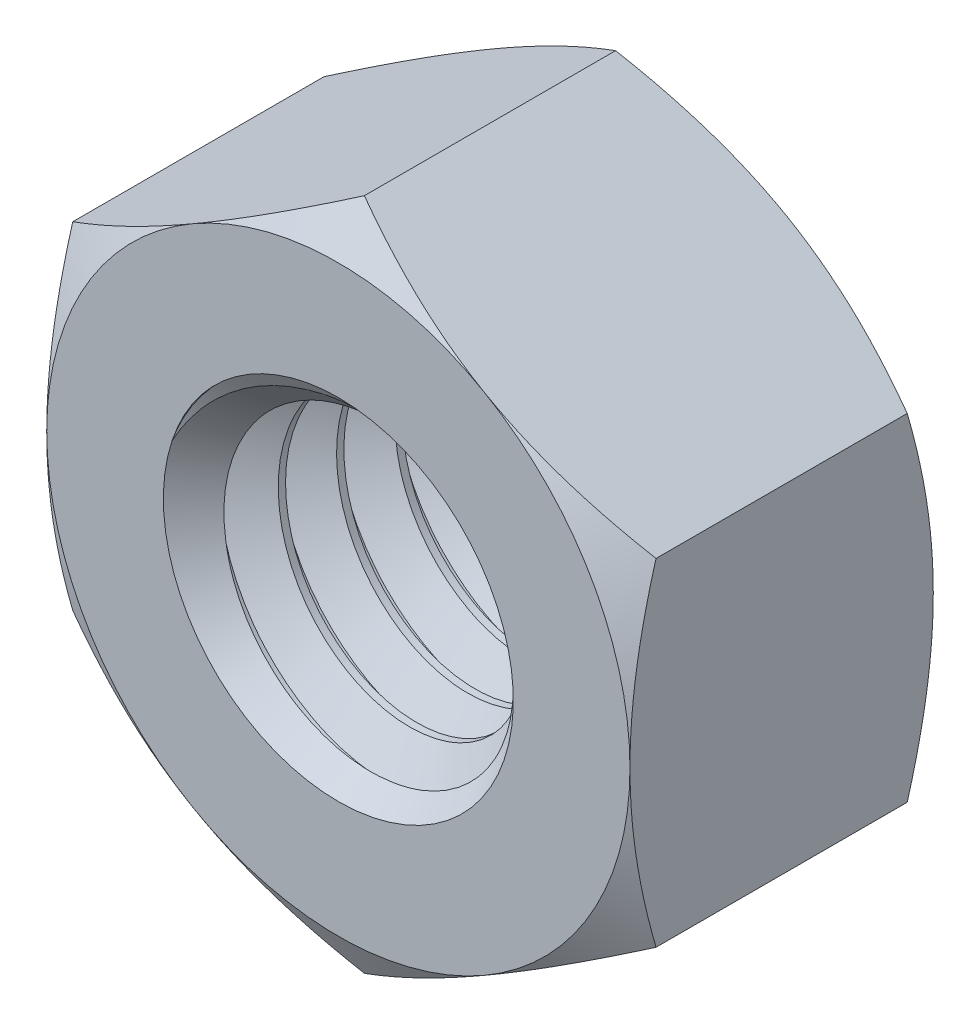
from build123d import *

# Parameters (mm, degrees)
EXTRUDE1_DEPTH          = 2.6
SKETCH13_R              = 3
BOSS_EXTRUDE1_DEPTH     = 5.2
CUT_SWEEP1_PITCH        = 1
SKETCH7_OUTSIDE_W       = 103.216
SKETCH7_OUTSIDE_H       = 104.764
SKETCH7_OUTSIDE_R       = 5
EXTRUDE2_DEPTH          = 25.4
EXTRUDE2_DRAFT          = -60
MIRROR2_COPY_1_SKETCH_W = 103.216
MIRROR2_COPY_1_SKETCH_H = 104.764
MIRROR2_COPY_1_SKETCH_R = 5
MIRROR2_COPY_1_DEPTH    = 25.4
MIRROR2_COPY_1_DRAFT    = -60


with BuildPart() as part:
    # Sketch1 → Extrude1 (new, symmetric)
    with BuildSketch(Plane.XY):
        Polygon((-5, 2.886751346), (-5, -2.886751346), (0, -5.773502692), (5, -2.886751346), (5, 2.886751346), (0, 5.773502692), align=None)
    extrude(amount=EXTRUDE1_DEPTH, both=True)

    # Cut-Extrude2 cone 1 section (through the dimple's axis) → Cut-Extrude2 (revolve, cut)
    with BuildSketch(Plane(origin=(0, 0, 2.6), x_dir=(0, -1, 0), z_dir=(1, 0, 0))):
        Polygon((0, 0), (3, 0), (0, 3), align=None)
    revolve(axis=Axis((0, 0, 2.6), (0, 0, -1)), mode=Mode.SUBTRACT)

    # Cut-Extrude3 cone 1 section (through the dimple's axis) → Cut-Extrude3 (revolve, cut)
    with BuildSketch(Plane(origin=(0, 0, -2.6), x_dir=(0, 1, 0), z_dir=(1, 0, 0))):
        Polygon((0, 0), (3, 0), (0, 3), align=None)
    revolve(axis=Axis((0, 0, -2.6), (0, 0, 1)), mode=Mode.SUBTRACT)


with BuildPart() as body_2:
    # Sketch13 → Boss-Extrude1 (new body)
    with BuildSketch(Plane(origin=(0, 0, -2.6), x_dir=(-1, 0, 0), z_dir=(0, 0, -1))):
        Circle(SKETCH13_R)
    extrude(amount=-BOSS_EXTRUDE1_DEPTH)

    # Cut-Sweep1: arcs per turn and ends read off the stored shape
    # Cut-Sweep1: the profile of Sketch12 profile screwed along a right-hand helix through 7 turns, 8 arcs to a turn; built about Z, then put on its axis
    cut_sweep1_z = Axis((0, 0, 0), (0, 0, 1))
    cut_sweep1_corners = [(3.0003, 0, -1.875173205), (3.0003, 0, -0.999826795), (2.350480947, 0, -1.375), (2.350480947, 0, -1.5)]
    with BuildLine(mode=Mode.PRIVATE) as cut_sweep1_profile:
        Line(cut_sweep1_corners[0], cut_sweep1_corners[1])
        Line(cut_sweep1_corners[1], cut_sweep1_corners[2])
        Line(cut_sweep1_corners[2], cut_sweep1_corners[3])
        Line(cut_sweep1_corners[3], cut_sweep1_corners[0])
    cut_sweep1_cap = Face(cut_sweep1_profile.wire())
    cut_sweep1_turn_angles = [0, 22.5, 45, 67.5, 90, 112.5, 135, 157.5, 180, 202.5, 225, 247.5, 270, 292.5, 315, 337.5, 360]
    cut_sweep1_turn_weights = [1, 0.9238795325112867, 1, 0.9238795325112867, 1, 0.9238795325112867, 1, 0.9238795325112867, 1, 0.9238795325112867, 1, 0.9238795325112867, 1, 0.9238795325112867, 1, 0.9238795325112867, 1]
    cut_sweep1_turn_rails = [Edge.make_bspline([Vector(p[0], p[1], 0).rotate(cut_sweep1_z, cut_sweep1_turn_angles[k]) / cut_sweep1_turn_weights[k] + Vector(0, 0, p[2] + CUT_SWEEP1_PITCH * cut_sweep1_turn_angles[k] / 360) for k in range(17)], [0, 0, 0, 1, 1, 2, 2, 3, 3, 4, 4, 5, 5, 6, 6, 7, 7, 8, 8, 8], 2, cut_sweep1_turn_weights) for p in cut_sweep1_corners]
    cut_sweep1_turn_sides = [Face.make_surface_from_curves(cut_sweep1_turn_rails[p[0]], cut_sweep1_turn_rails[p[1]]) for p in [(0, 1), (1, 2), (2, 3), (3, 0)]]
    cut_sweep1 = Plane(origin=(0, 0, -2.6), x_dir=(0, 1, 0), z_dir=(0, 0, 1)) * Solid(Shell([*[p.moved(Location((0, 0, CUT_SWEEP1_PITCH * i))) for i in range(7) for p in cut_sweep1_turn_sides], cut_sweep1_cap, cut_sweep1_cap.rotate(cut_sweep1_z, 2520).moved(Location((0, 0, CUT_SWEEP1_PITCH * 2520 / 360)))]))
    add(cut_sweep1, mode=Mode.SUBTRACT)


with BuildPart() as part_1:
    add(part.part)

    # Combine1: cut body 2
    add(body_2.part, mode=Mode.SUBTRACT)


with BuildPart() as extrude2_tool:
    # Sketch7 outside → Extrude2 (with draft: the straight prism first)
    with BuildSketch(Plane.XY.offset(2.6)):
        Rectangle(SKETCH7_OUTSIDE_W, SKETCH7_OUTSIDE_H)
        Circle(SKETCH7_OUTSIDE_R, mode=Mode.SUBTRACT)
    extrude(amount=-EXTRUDE2_DEPTH)
    # Extrude2: the draft: its side faces are tilted about the plane it starts from
    extrude2_sides = [extrude2_tool.faces().sort_by_distance(p)[0] for p in [
        (0, -52.382, -10.1),
        (51.608, 0, -10.1),
        (0, 52.382, -10.1),
        (-51.608, 0, -10.1),
        (-5, 0, -10.1),
    ]]
    draft(extrude2_sides, Plane.XY.offset(2.6), EXTRUDE2_DRAFT)


with BuildPart() as part_2:
    add(part_1.part)

    # Extrude2: cut by extrude2_tool
    add(extrude2_tool.part, mode=Mode.SUBTRACT)


with BuildPart() as mirror2_copy_1_tool:
    # Mirror2 copy 1 sketch → Mirror2 copy 1 (with draft: the straight prism first)
    with BuildSketch(Plane(origin=(0, 0, -2.6), x_dir=(1, 0, 0), z_dir=(0, 0, -1))):
        Rectangle(MIRROR2_COPY_1_SKETCH_W, MIRROR2_COPY_1_SKETCH_H)
        Circle(MIRROR2_COPY_1_SKETCH_R, mode=Mode.SUBTRACT)
    extrude(amount=-MIRROR2_COPY_1_DEPTH)
    # Mirror2 copy 1: the draft: its side faces are tilted about the plane it starts from
    mirror2_copy_1_sides = [mirror2_copy_1_tool.faces().sort_by_distance(p)[0] for p in [
        (0, -52.382, 10.1),
        (51.608, 0, 10.1),
        (0, 52.382, 10.1),
        (-51.608, 0, 10.1),
        (-5, 0, 10.1),
    ]]
    draft(mirror2_copy_1_sides, Plane(origin=(0, 0, -2.6), x_dir=(1, 0, 0), z_dir=(0, 0, -1)), MIRROR2_COPY_1_DRAFT)


with BuildPart() as part_3:
    add(part_2.part)

    # Mirror2 copy 1: cut by mirror2_copy_1_tool
    add(mirror2_copy_1_tool.part, mode=Mode.SUBTRACT)


solid = part_3.part
